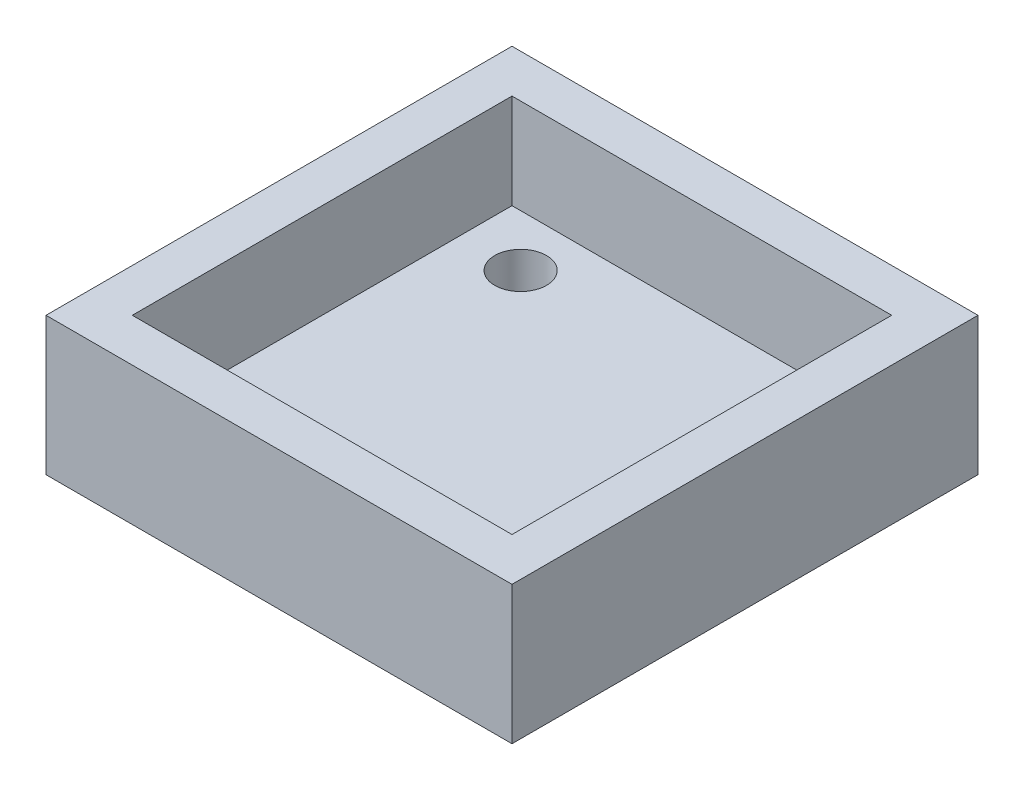
from build123d import *

# Parameters (mm, degrees)
SKETCH2_W           = 27
SKETCH2_H           = 27
BOSS_EXTRUDE1_DEPTH = 8
SKETCH5_W           = 22
SKETCH5_H           = 22
CUT_EXTRUDE2_DEPTH  = 5.5
SKETCH3_R           = 1.5
CUT_EXTRUDE3_DEPTH  = 10
CUT_EXTRUDE4_DEPTH  = 10


with BuildPart() as part:
    # Sketch2 → Boss-Extrude1 (new body)
    with BuildSketch(Plane(origin=(0, 0, 0), x_dir=(1, 0, 0), z_dir=(0, 1, 0))):
        with Locations((13.5, 13.5)):
            Rectangle(SKETCH2_W, SKETCH2_H)
    extrude(amount=BOSS_EXTRUDE1_DEPTH)

    # Sketch5 → Cut-Extrude2 (cut)
    with BuildSketch(Plane(origin=(0, 8, 0), x_dir=(1, 0, 0), z_dir=(0, 1, 0))):
        with Locations((13.5, 13.5)):
            Rectangle(SKETCH5_W, SKETCH5_H)
    extrude(amount=-CUT_EXTRUDE2_DEPTH, mode=Mode.SUBTRACT)

    # Sketch3 → Cut-Extrude3 (cut)
    with BuildSketch(Plane(origin=(0, 0, 0), x_dir=(-1, 0, 0), z_dir=(0, -1, 0))):
        with Locations((-6, 21.5)):
            Circle(SKETCH3_R)
        with Locations((-6, 5.5)):
            Circle(SKETCH3_R)
    extrude(amount=-CUT_EXTRUDE3_DEPTH, mode=Mode.SUBTRACT)

    # Sketch6 → Cut-Extrude4 (cut)
    with BuildSketch(Plane(origin=(0, 2.5, 0), x_dir=(1, 0, 0), z_dir=(0, 1, 0))):
        with BuildLine():
            ThreePointArc((22.25, 24), (20.305456352, 23.194543648), (19.5, 21.25))
            Line((19.5, 21.25), (19.5, 5.75))
            ThreePointArc((19.5, 5.75), (20.305456352, 3.805456352), (22.25, 3))
            ThreePointArc((22.25, 3), (23.865824645, 3.9734162), (24.5, 5.75))
            Line((24.5, 5.75), (24.5, 21.25))
            ThreePointArc((24.5, 21.25), (23.865824645, 23.0265838), (22.25, 24))
        make_face()
    extrude(amount=-CUT_EXTRUDE4_DEPTH, mode=Mode.SUBTRACT)


solid = part.part
